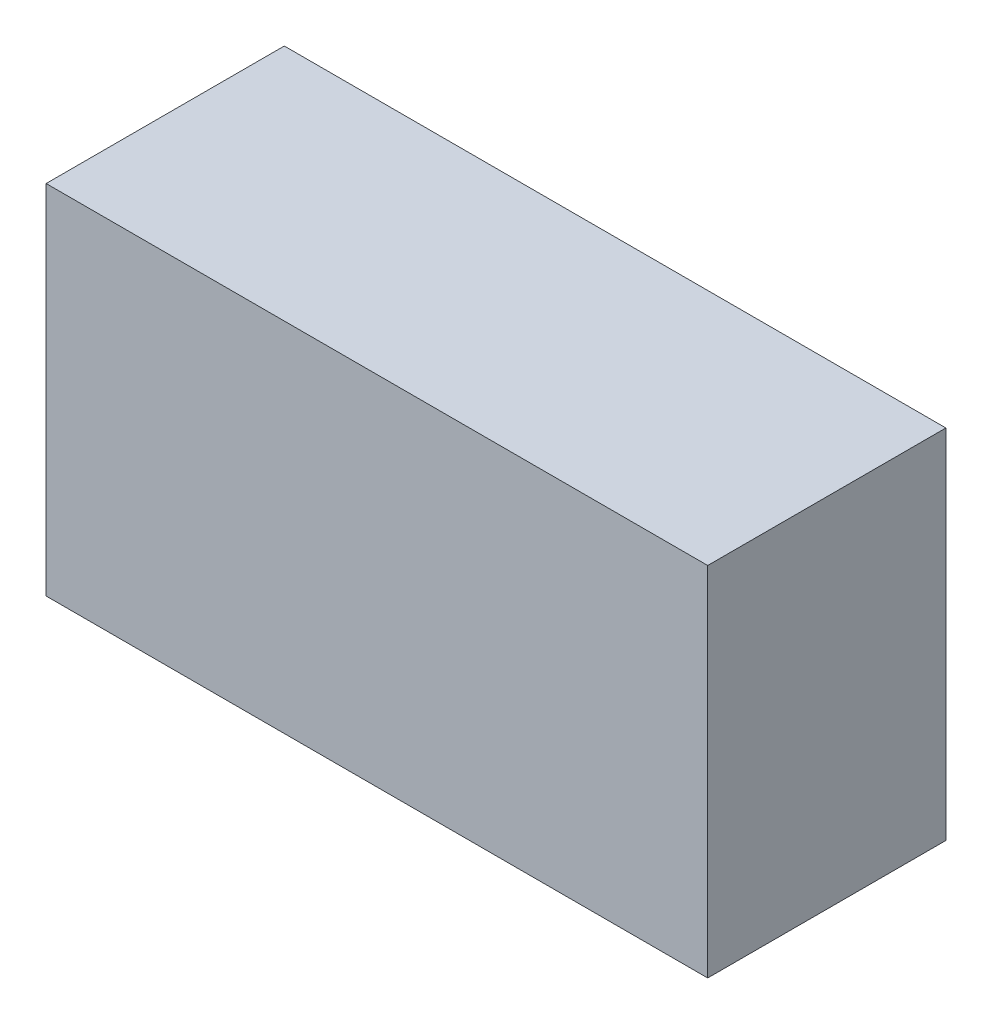
from build123d import *

# Parameters (mm, degrees)
BOSS_EXTRUDE1_DEPTH = 18
SKETCH2_R           = 3.0000000000000004
SKETCH2_R_2         = 3.0000000000000013
BOSS_EXTRUDE3_DEPTH = 2
FILLET1_R           = 1
SKETCH3_R           = 2.250000000000001
CUT_EXTRUDE1_DEPTH  = 2
FILLET3_R           = 1


with BuildPart() as part:
    # Sketch1 → Boss-Extrude1 (new body)
    with BuildSketch(Plane.XY):
        Polygon((-50, 27), (0, 27.000000000000007), (0, 0), (-49.999999999999986, 0), align=None)
    extrude(amount=BOSS_EXTRUDE1_DEPTH)

    # Sketch2 → Boss-Extrude3 (add)
    with BuildSketch(Plane.ZY.offset(49.999999999999986)):
        with Locations(Location((9, 20.250000000000025, 0), (0, 0, 90))):
            Circle(SKETCH2_R)
        with Locations(Location((9, 6.749999999999998, 0), (0, 0, 90))):
            Circle(SKETCH2_R_2)
    extrude(amount=BOSS_EXTRUDE3_DEPTH)

    # Fillet1
    fillet1_edges = [part.edges().sort_by_distance(p)[0] for p in [
        (-51.99999999999999, 17.249999999999996, 9),
    ]]
    fillet(fillet1_edges, radius=FILLET1_R)

    # Sketch3 → Cut-Extrude1 (cut)
    with BuildSketch(Plane.ZY.offset(51.99999999999999)):
        with Locations(Location((9, 6.749999999999998, 0), (0, 0, 270))):
            Circle(SKETCH3_R)
    extrude(amount=-CUT_EXTRUDE1_DEPTH, mode=Mode.SUBTRACT)

    # Fillet3
    # the kernel refuses this fillet: 1 mm, written as the material it takes off along each edge
    with BuildSketch(Plane(origin=(-51.99999999999999, 6.749999999999972, 9), x_dir=(0, -1, 0), z_dir=(0, 0, -1))) as fillet3_piece_1:
        with BuildLine():
            CenterArc((3.25, -0.9682458365518585), FILLET3_R, 104.47751218592994, 75.52248781407006)
            Line((2.25, -0.9682458365518585), (2.2300000000000004, -0.9682458365518585))
            Line((2.2300000000000004, -0.9682458365518585), (2.2300000000000013, 0))
            Line((2.2300000000000013, 0), (2.250000000000001, 0.02000000000000313))
            ThreePointArc((2.250000000000001, 0.02000000000000313), (2.625000000000001, 0.01999999999999602), (2.9950000000000006, 0.01936491673102836))
            Line((2.9950000000000006, 0.01936491673102836), (3.0000000000000004, -7.11e-15))
        make_face()
    revolve(axis=Axis((-51.99999999999999, 6.749999999999972, 9), (-1, -5.1e-16, 0)), mode=Mode.SUBTRACT)


solid = part.part
